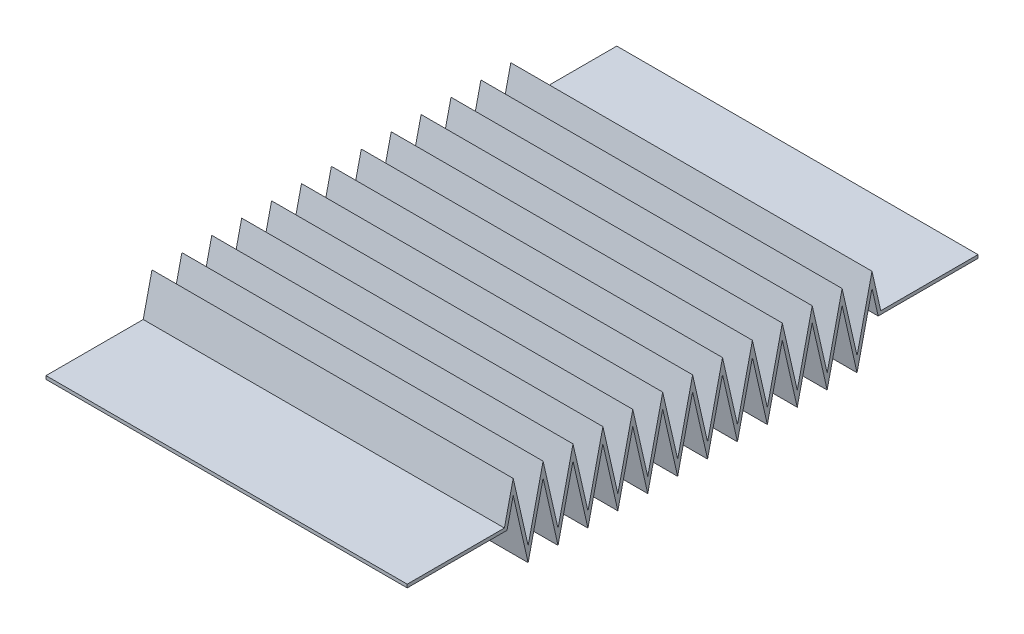
from build123d import *

# Parameters (mm, degrees)
EXTRUDE_THIN1_DEPTH = 27.5


with BuildPart() as part:
    # Sketch3 → Extrude-Thin1 (new, symmetric)
    with BuildSketch(Plane(origin=(0, 0, 0), x_dir=(0, 0, -1), z_dir=(1, 0, 0))):
        Polygon((0, 4.75), (15.199483191, 4.75), (16.138264157, 8.87373947), (18.414792472, -1.12626053), (20.691320786, 8.87373947), (22.967849101, -1.12626053), (25.244377416, 8.87373947), (27.52090573, -1.12626053), (29.797434045, 8.87373947), (32.073962359, -1.12626053), (34.350490674, 8.87373947), (36.627018988, -1.12626053), (38.903547303, 8.87373947), (41.180075617, -1.12626053), (43.456603932, 8.87373947), (45.733132247, -1.12626053), (48.009660561, 8.87373947), (50.286188876, -1.12626053), (52.56271719, 8.87373947), (54.839245505, -1.12626053), (57.115773819, 8.87373947), (59.392302134, -1.12626053), (61.668830448, 8.87373947), (63.945358763, -1.12626053), (66.221887078, 8.87373947), (68.498415392, -1.12626053), (70.774943707, 8.87373947), (71.713724673, 4.75), (86.913207864, 4.75), (86.913207864, 5.25), (72.112691055, 5.25), (70.774943707, 11.12626053), (68.498415392, 1.12626053), (66.221887078, 11.12626053), (63.945358763, 1.12626053), (61.668830448, 11.12626053), (59.392302134, 1.12626053), (57.115773819, 11.12626053), (54.839245505, 1.12626053), (52.56271719, 11.12626053), (50.286188876, 1.12626053), (48.009660561, 11.12626053), (45.733132247, 1.12626053), (43.456603932, 11.12626053), (41.180075617, 1.12626053), (38.903547303, 11.12626053), (36.627018988, 1.12626053), (34.350490674, 11.12626053), (32.073962359, 1.12626053), (29.797434045, 11.12626053), (27.52090573, 1.12626053), (25.244377416, 11.12626053), (22.967849101, 1.12626053), (20.691320786, 11.12626053), (18.414792472, 1.12626053), (16.138264157, 11.12626053), (14.800516809, 5.25), (0, 5.25), align=None)
    extrude(amount=EXTRUDE_THIN1_DEPTH, both=True)


solid = part.part
